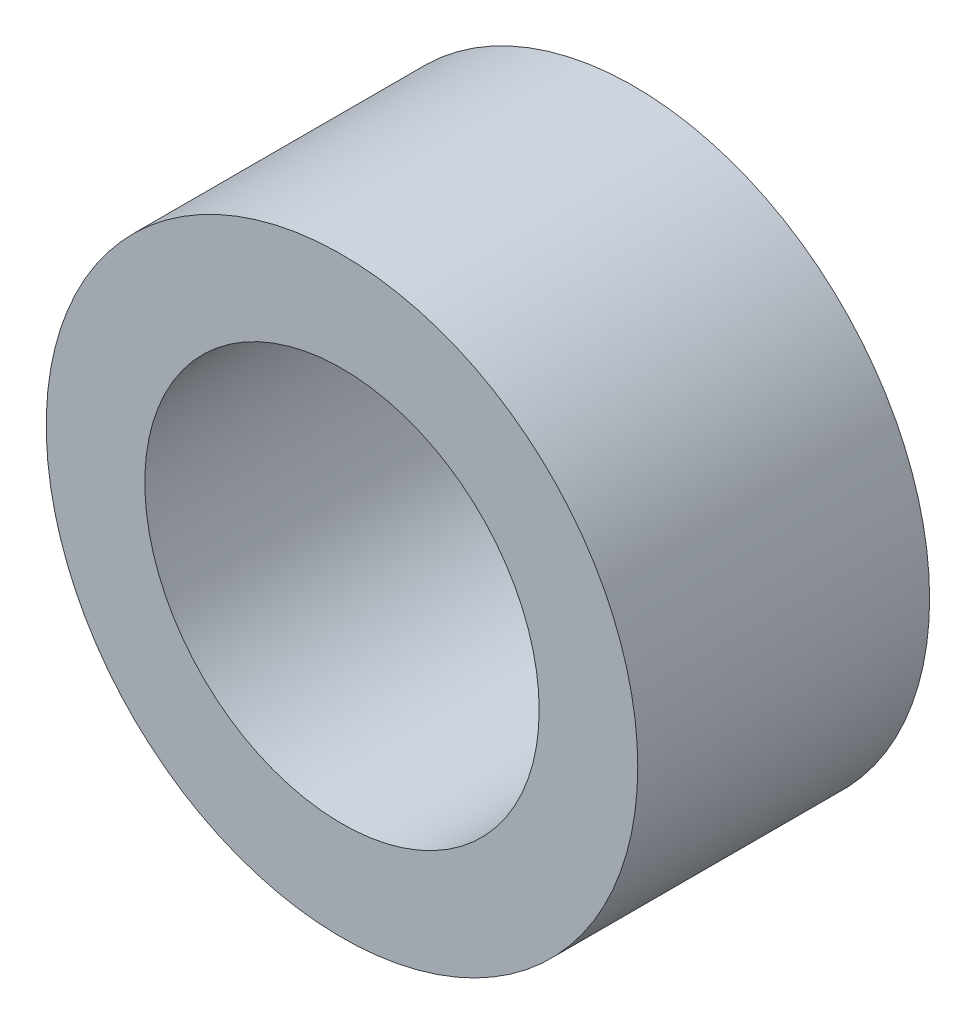
from build123d import *

# Parameters (mm, degrees)
SKETCH1_R           = 9.525
SKETCH1_R_2         = 6.35
BOSS_EXTRUDE1_DEPTH = 4.699


with BuildPart() as part:
    # Sketch1 → Boss-Extrude1 (new, symmetric)
    with BuildSketch(Plane.XY):
        Circle(SKETCH1_R)
        Circle(SKETCH1_R_2, mode=Mode.SUBTRACT)
    extrude(amount=BOSS_EXTRUDE1_DEPTH, both=True)


solid = part.part
